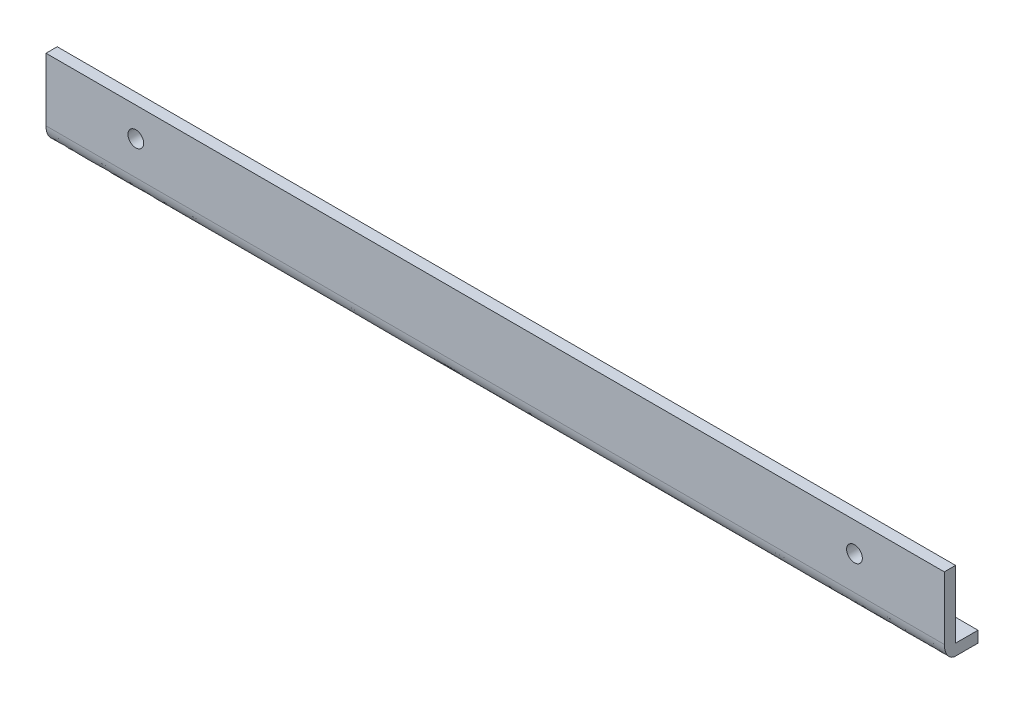
from build123d import *

# Parameters (mm, degrees)
SKETCH_1_W      = 400
SKETCH_1_H      = 35
SKETCH_1_R      = 3.5
EXTRUDE_1_DEPTH = 5
SKETCH_2_W      = 400
SKETCH_2_H      = 5
EXTRUDE_2_DEPTH = 10
FILLET_1_SIZE   = 7
FILLET_1_SIZE_2 = 5


with BuildPart() as part:
    # 草图1 → 凸台-拉伸1 (new body)
    with BuildSketch(Plane.XY):
        with Locations((32.704402516, 130.419346185)):
            Rectangle(SKETCH_1_W, SKETCH_1_H)
        with Locations((-127.295597484, 134.919346185)):
            Circle(SKETCH_1_R, mode=Mode.SUBTRACT)
        with Locations(Location((192.704402516, 134.919346185, 0), (0, 0, 180))):
            Circle(SKETCH_1_R, mode=Mode.SUBTRACT)
    extrude(amount=EXTRUDE_1_DEPTH)

    # 草图2 → 凸台-拉伸2 (add)
    with BuildSketch(Plane(origin=(0, 0, 0), x_dir=(-1, 0, 0), z_dir=(0, 0, -1))):
        with Locations((-32.704402516, 115.419346185)):
            Rectangle(SKETCH_2_W, SKETCH_2_H)
    extrude(amount=EXTRUDE_2_DEPTH)

    # 圆角1
    # an asymmetric fillet: 7, 5 mm, written as the material it takes off along each edge
    with BuildSketch(Plane(origin=(250.204402516, 112.919346185, 5), x_dir=(0, 1, 0), z_dir=(-1, 0, 0))) as fillet_1_piece_1:
        with BuildLine():
            Bezier((FILLET_1_SIZE, 0), (0, 0), (0, FILLET_1_SIZE_2), weights=[1, 0.707106781, 1])
            Line((0, FILLET_1_SIZE_2), (0, 0))
            Line((0, 0), (FILLET_1_SIZE, 0))
        make_face()
    extrude(amount=435, mode=Mode.SUBTRACT)


solid = part.part
